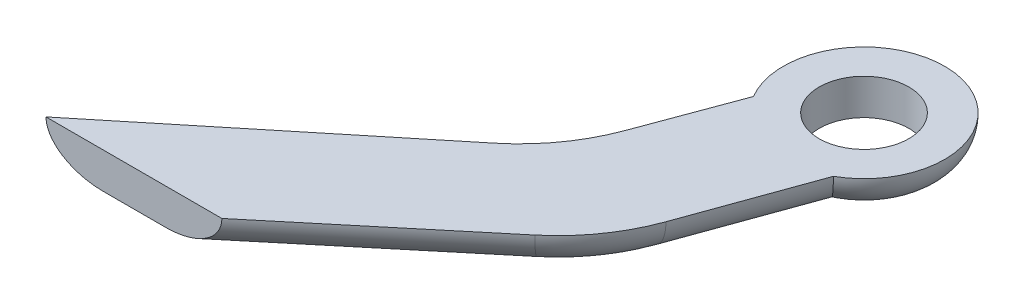
from build123d import *

# Parameters (mm, degrees)
SKETCH1_R           = 2.5000000000000004
BOSS_EXTRUDE1_DEPTH = 2
FILLET1_R           = 10
FILLET2_R           = 10
FILLET3_R           = 2
FILLET4_R           = 2


with BuildPart() as part:
    # Sketch1 → Boss-Extrude1 (new body)
    with BuildSketch(Plane(origin=(0, 0, 0), x_dir=(1, 0, 0), z_dir=(0, 1, 0))):
        with BuildLine():
            Line((4.734439187943633, 4.337505524576787), (-11.123424173439652, -8.60036927980545))
            Line((-11.123424173439652, -8.60036927980545), (-1.3192163601402593, -8.60036927980545))
            Line((-1.3192163601402593, -8.60036927980545), (10.29708605182919, 1.0617245936219641))
            Line((10.29708605182919, 1.0617245936219641), (13.693514413313048, 10.480195617492226))
            ThreePointArc((13.693514413313048, 10.480195617492226), (12.643820805599, 18.747230765158918), (7.611903426882685, 12.104525420451473))
            Line((7.611903426882685, 12.104525420451473), (4.734439187943633, 4.337505524576787))
        make_face()
        with Locations(Location((11.482625796556237, 14.39963072019455, 0), (0, 0, 270))):
            Circle(SKETCH1_R, mode=Mode.SUBTRACT)
    extrude(amount=BOSS_EXTRUDE1_DEPTH)

    # Fillet1
    fillet1_edges = [part.edges().sort_by_distance(p)[0] for p in [
        (10.29708605182919, 1, -1.0617245936219641),
    ]]
    fillet(fillet1_edges, radius=FILLET1_R)

    # Fillet2
    fillet2_edges = [part.edges().sort_by_distance(p)[0] for p in [
        (4.734439187943633, 1, -4.337505524576787),
    ]]
    fillet(fillet2_edges, radius=FILLET2_R)

    # Fillet3
    fillet3_edges = [part.edges().sort_by_distance(p)[0] for p in [
        (6.6461096923169105, 0, -9.49759844281185),
        (4.438286722207531, 0, -4.549211293465088),
        (12.456410034317898, 0, -7.049641368446211),
        (9.999920903343424, 0, -1.270100820961935),
        (-4.249333346620522, 0, 2.9920395518602865),
        (3.4439024153195033, 0, 4.638549149214148),
    ]]
    fillet(fillet3_edges, radius=FILLET3_R - 0.0001)  # a hair under: the kernel refuses the full size

    # Fillet4
    fillet4_edges = [part.edges().sort_by_distance(p)[0] for p in [
        (12.744313913733468, 3.2e-16, -18.719137994754206),
    ]]
    fillet(fillet4_edges, radius=FILLET4_R - 0.0001)  # a hair under: the kernel refuses the full size


solid = part.part
